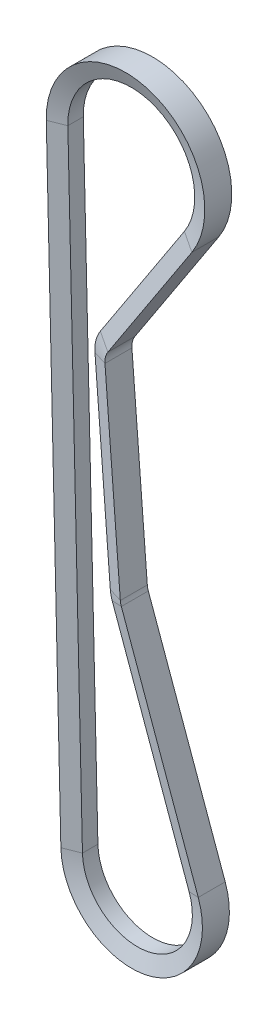
from build123d import *


with BuildPart() as part:
    # Sweep1: sweep along a path in Sketch2
    with BuildLine(Plane.XY) as sweep1_path:
        Line((-24.993140187, -0.585613847), (-30.146062876, 219.333569918))
        ThreePointArc((-30.146062876, 219.333569918), (5.530334366, 246.914444167), (21.27605104, 204.658292534))
        Line((21.27605104, 204.658292534), (-8.408452526, 159.29305808))
        ThreePointArc((-8.408452526, 159.29305808), (-9.246100655, 157.392666571), (-9.425779573, 155.323643188))
        Line((-9.425779573, 155.323643188), (-3.996362293, 85.534522059))
        ThreePointArc((-3.996362293, 85.534522059), (-3.873744361, 84.692842815), (-3.639739072, 83.875101639))
        Line((-3.639739072, 83.875101639), (23.520657689, 8.472228861))
        ThreePointArc((23.520657689, 8.472228861), (4.588374418, -24.575329503), (-24.993140187, -0.585613847))
    # Sketch3 → Sweep1 (sweep)
    with BuildSketch(Plane(origin=(23.520657689, 8.472228861, 0), x_dir=(-0.940826307568208, -0.33888915442600387, 0), z_dir=(0.33888915442600387, -0.9408263075682081, 0))):
        Polygon((0, -4.7625), (0, 4.7625), (5.588, 2.728634331), (5.588, -2.728634331), align=None)
    sweep(path=sweep1_path.line)


solid = part.part
